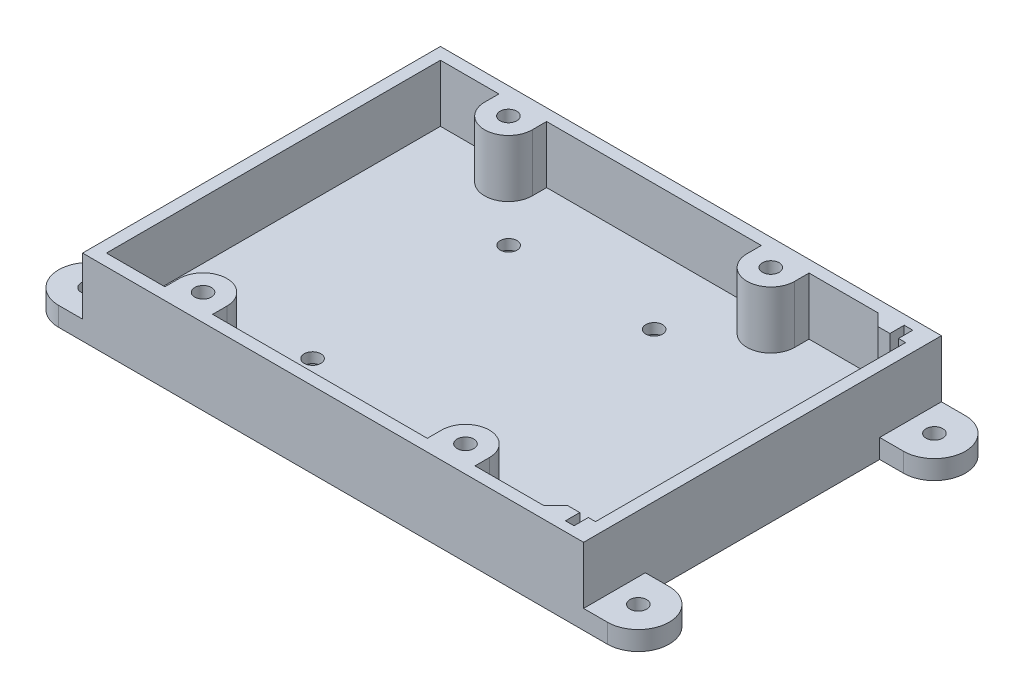
from build123d import *

# Parameters (mm, degrees)
SKETCH2_R           = 1.75
BOSS_EXTRUDE1_DEPTH = 4
SKETCH4_R           = 1.75
BOSS_EXTRUDE2_DEPTH = 12
SKETCH6_R           = 3.5
CUT_EXTRUDE1_DEPTH  = 1.85
SKETCH9_R           = 3.5
CUT_EXTRUDE3_DEPTH  = 3


with BuildPart() as part:
    # Sketch2 → Boss-Extrude1 (new body)
    with BuildSketch(Plane(origin=(0, 0, 0), x_dir=(1, 0, 0), z_dir=(0, 1, 0))):
        with BuildLine():
            Line((0, 75), (105, 75))
            Line((105, 75), (110, 75))
            ThreePointArc((110, 75), (116.471194078, 68.528805922), (110, 62.057611845))
            Line((110, 62.057611845), (105, 62.057611845))
            Line((105, 62.057611845), (105, 12.942388155))
            Line((105, 12.942388155), (110, 12.942388155))
            ThreePointArc((110, 12.942388155), (116.471194078, 6.471194078), (110, 0))
            Line((110, 0), (105, 0))
            Line((105, 0), (0, 0))
            Line((0, 0), (-5, 0))
            ThreePointArc((-5, 0), (-11.471194078, 6.471194078), (-5, 12.942388155))
            Line((-5, 12.942388155), (0, 12.942388155))
            Line((0, 12.942388155), (0, 62.057611845))
            Line((0, 62.057611845), (-5, 62.057611845))
            ThreePointArc((-5, 62.057611845), (-11.471194078, 68.528805922), (-5, 75))
            Line((-5, 75), (0, 75))
        make_face()
        with Locations((-5, 68.528805922)):
            Circle(SKETCH2_R, mode=Mode.SUBTRACT)
        with Locations((110, 68.528805922)):
            Circle(SKETCH2_R, mode=Mode.SUBTRACT)
        with Locations((110, 6.471194078)):
            Circle(SKETCH2_R, mode=Mode.SUBTRACT)
        with Locations((-5, 6.471194078)):
            Circle(SKETCH2_R, mode=Mode.SUBTRACT)
        with Locations((31.25, 16.95)):
            Circle(SKETCH2_R, mode=Mode.SUBTRACT)
        with Locations((31.25, 58.05)):
            Circle(SKETCH2_R, mode=Mode.SUBTRACT)
        with Locations((61.75, 58.05)):
            Circle(SKETCH2_R, mode=Mode.SUBTRACT)
        with Locations((61.75, 16.95)):
            Circle(SKETCH2_R, mode=Mode.SUBTRACT)
        with Locations((74.75, 5.5)):
            Circle(SKETCH2_R, mode=Mode.SUBTRACT)
        with Locations((19.75, 5.5)):
            Circle(SKETCH2_R, mode=Mode.SUBTRACT)
        with Locations((19.75, 69.5)):
            Circle(SKETCH2_R, mode=Mode.SUBTRACT)
        with Locations((74.75, 69.5)):
            Circle(SKETCH2_R, mode=Mode.SUBTRACT)
    extrude(amount=BOSS_EXTRUDE1_DEPTH)

    # Sketch4 → Boss-Extrude2 (add)
    with BuildSketch(Plane(origin=(0, 4, 0), x_dir=(1, 0, 0), z_dir=(0, 1, 0))):
        Polygon((94.2, 75), (105, 75), (105, 0), (94.2, 0), (0, 0), (0, 75), align=None)
        with Locations((74.75, 5.5)):
            Circle(SKETCH4_R, mode=Mode.SUBTRACT)
        with Locations((19.75, 5.5)):
            Circle(SKETCH4_R, mode=Mode.SUBTRACT)
        with Locations((19.75, 69.5)):
            Circle(SKETCH4_R, mode=Mode.SUBTRACT)
        with Locations((74.75, 69.5)):
            Circle(SKETCH4_R, mode=Mode.SUBTRACT)
        with BuildLine():
            Line((102.5, 70), (102.5, 5))
            Line((102.5, 5), (101, 5))
            Line((101, 5), (101, 2))
            Line((101, 2), (99.2, 2))
            Line((99.2, 2), (99.2, 5))
            Line((99.2, 5), (96.7, 5))
            Line((96.7, 5), (94.2, 2.5))
            Line((94.2, 2.5), (79.75, 2.5))
            Line((79.75, 2.5), (79.75, 5.5))
            ThreePointArc((79.75, 5.5), (74.75, 10.5), (69.75, 5.5))
            Line((69.75, 5.5), (69.75, 2.5))
            Line((69.75, 2.5), (24.75, 2.5))
            Line((24.75, 2.5), (24.75, 5.5))
            ThreePointArc((24.75, 5.5), (19.75, 10.5), (14.75, 5.5))
            Line((14.75, 5.5), (14.75, 2.5))
            Line((14.75, 2.5), (2.5, 2.5))
            Line((2.5, 2.5), (2.5, 72.5))
            Line((2.5, 72.5), (14.75, 72.5))
            Line((14.75, 72.5), (14.75, 69.5))
            ThreePointArc((14.75, 69.5), (19.75, 64.5), (24.75, 69.5))
            Line((24.75, 69.5), (24.75, 72.5))
            Line((24.75, 72.5), (69.75, 72.5))
            Line((69.75, 72.5), (69.75, 69.5))
            ThreePointArc((69.75, 69.5), (74.75, 64.5), (79.75, 69.5))
            Line((79.75, 69.5), (79.75, 72.5))
            Line((79.75, 72.5), (94.2, 72.5))
            Line((94.2, 72.5), (96.7, 70))
            Line((96.7, 70), (99.2, 70))
            Line((99.2, 70), (99.2, 73))
            Line((99.2, 73), (101, 73))
            Line((101, 73), (101, 70))
            Line((101, 70), (102.5, 70))
        make_face(mode=Mode.SUBTRACT)
    extrude(amount=BOSS_EXTRUDE2_DEPTH)

    # Sketch6 → Cut-Extrude1 (cut)
    with BuildSketch(Plane.XZ):
        with Locations((61.75, -16.95)):
            Circle(SKETCH6_R)
        with Locations((61.75, -58.05)):
            Circle(SKETCH6_R)
        with Locations((31.25, -58.05)):
            Circle(SKETCH6_R)
        with Locations((31.25, -16.95)):
            Circle(SKETCH6_R)
    extrude(amount=-CUT_EXTRUDE1_DEPTH, mode=Mode.SUBTRACT)

    # Sketch9 → Cut-Extrude3 (cut)
    with BuildSketch(Plane.XZ):
        with Locations((19.75, -69.5)):
            Circle(SKETCH9_R)
        with Locations((19.75, -5.5)):
            Circle(SKETCH9_R)
        with Locations((74.75, -5.5)):
            Circle(SKETCH9_R)
        with Locations((74.75, -69.5)):
            Circle(SKETCH9_R)
    extrude(amount=-CUT_EXTRUDE3_DEPTH, mode=Mode.SUBTRACT)


solid = part.part
